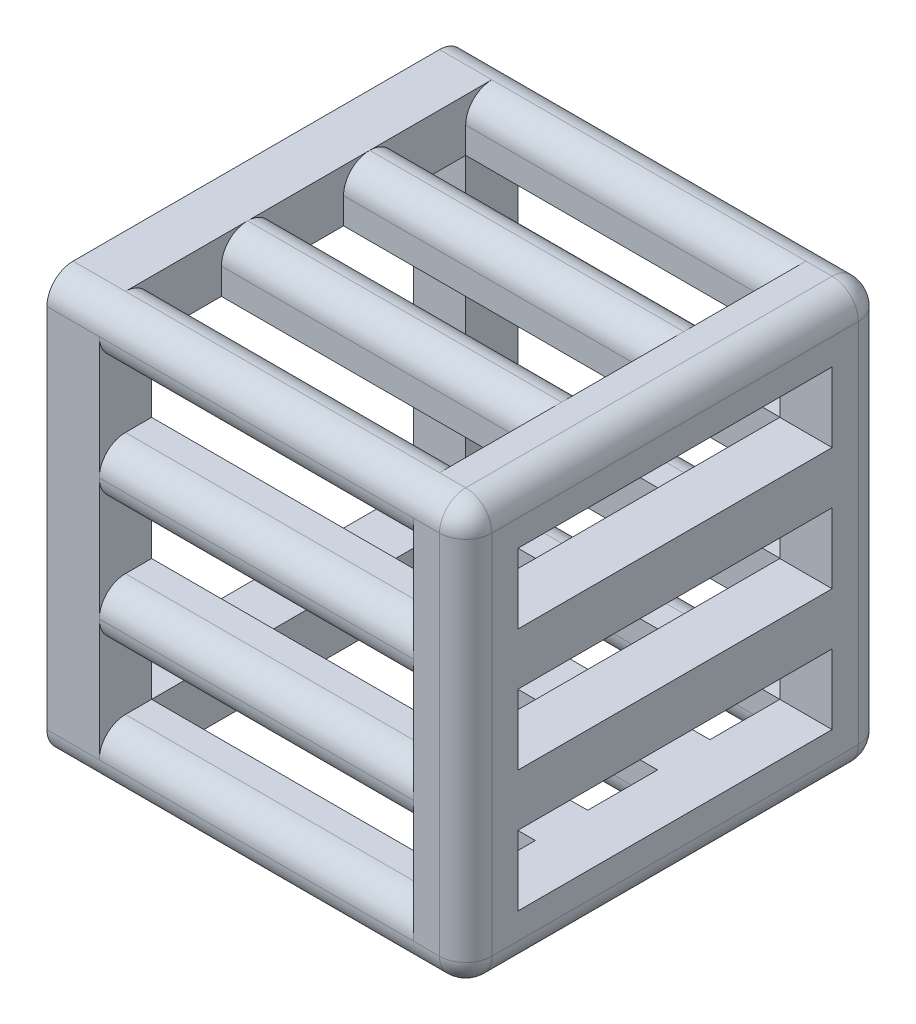
from build123d import *

# Parameters (mm, degrees)
SKETCH_1_W      = 16
SKETCH_1_H      = 16
SKETCH_1_W_2    = 12
SKETCH_1_H_2    = 12
EXTRUDE_1_DEPTH = 2
SKETCH_2_W      = 2
SKETCH_2_H      = 2
EXTRUDE_2_DEPTH = 12
SKETCH_3_W      = 2
SKETCH_3_H      = 2
SKETCH_3_W_2    = 12
SKETCH_3_H_2    = 1.99
EXTRUDE_3_DEPTH = 2
FILLET_1_R      = 1
FILLET_2_R      = 1


with BuildPart() as part:
    # 草图1 → 凸台-拉伸1 (new body)
    with BuildSketch(Plane(origin=(0, 0, 0), x_dir=(0, 0, -1), z_dir=(1, 0, 0))):
        with Locations((8, -8)):
            Rectangle(SKETCH_1_W, SKETCH_1_H)
        with Locations((8, -8)):
            Rectangle(SKETCH_1_W_2, SKETCH_1_H_2, mode=Mode.SUBTRACT)
    extrude(amount=EXTRUDE_1_DEPTH)

    # 草图2 → 凸台-拉伸2 (add)
    with BuildSketch(Plane(origin=(2, 0, 0), x_dir=(0, 0, -1), z_dir=(1, 0, 0))):
        with Locations((5.666666, -1)):
            Rectangle(SKETCH_2_W, SKETCH_2_H)
        with Locations((1, -1)):
            Rectangle(SKETCH_2_W, SKETCH_2_H)
        with Locations((10.333332, -1)):
            Rectangle(SKETCH_2_W, SKETCH_2_H)
        with Locations((15, -1)):
            Rectangle(SKETCH_2_W, SKETCH_2_H)
        with Locations((1, -5.67)):
            Rectangle(SKETCH_2_W, SKETCH_2_H)
        with Locations((1, -10.34)):
            Rectangle(SKETCH_2_W, SKETCH_2_H)
        with Locations((1, -15)):
            Rectangle(SKETCH_2_W, SKETCH_2_H)
        with Locations((10.33, -15)):
            Rectangle(SKETCH_2_W, SKETCH_2_H)
        with Locations((15, -15)):
            Rectangle(SKETCH_2_W, SKETCH_2_H)
        with Locations((5.66, -15)):
            Rectangle(SKETCH_2_W, SKETCH_2_H)
        with Locations((15, -10.33)):
            Rectangle(SKETCH_2_W, SKETCH_2_H)
        with Locations((15, -5.66)):
            Rectangle(SKETCH_2_W, SKETCH_2_H)
    extrude(amount=EXTRUDE_2_DEPTH)

    # 草图3 → 凸台-拉伸3 (add)
    with BuildSketch(Plane(origin=(14, 0, 0), x_dir=(0, 0, -1), z_dir=(1, 0, 0))):
        with Locations((1, -1)):
            Rectangle(SKETCH_3_W, SKETCH_3_H)
        Polygon((2, -2), (0, -2), (0, -16), (2, -16), (2, -14), (2, -11.33), (2, -9.34), (2, -6.66), (2, -4.67), align=None)
        Polygon((2, -14), (2, -16), (16, -16), (16, -14), (14, -14), align=None)
        Polygon((16, 0), (14, 0), (14, -2), (14, -4.67), (14, -6.66), (14, -9.34), (14, -11.33), (14, -14), (16, -14), align=None)
        with Locations((8, -1)):
            Rectangle(SKETCH_3_W_2, SKETCH_3_H)
        with Locations((8, -5.665)):
            Rectangle(SKETCH_3_W_2, SKETCH_3_H_2)
        with Locations((8, -10.335)):
            Rectangle(SKETCH_3_W_2, SKETCH_3_H_2)
    extrude(amount=EXTRUDE_3_DEPTH)

    # 圆角1
    fillet_1_edges = [part.edges().sort_by_distance(p)[0] for p in [
        (16, -16, -8),
        (16, -8, -16),
        (16, 0, -8),
        (16, -8, 0),
        (8, 0, 0),
        (8, 0, -16),
        (8, -16, -16),
        (8, -16, 0),
    ]]
    fillet(fillet_1_edges, radius=FILLET_1_R)

    # 圆角2
    fillet_2_edges = [part.edges().sort_by_distance(p)[0] for p in [
        (8, -16, -2),
        (8, -14, 0),
        (8, -16, -9.33),
        (8, -16, -11.33),
        (8, -16, -4.66),
        (8, -16, -6.66),
        (8, -11.33, -16),
        (8, -9.33, -16),
        (8, -6.66, -16),
        (8, -4.66, -16),
        (8, -2, 0),
        (8, 0, -2),
        (8, -14, -16),
        (8, -16, -14),
        (8, 0, -6.666666),
        (8, 0, -4.666666),
        (8, 0, -11.333332),
        (8, 0, -9.333332),
        (8, 0, -14),
        (8, -2, -16),
        (8, -4.67, 0),
        (8, -6.67, 0),
        (8, -9.34, 0),
        (8, -11.34, 0),
    ]]
    fillet(fillet_2_edges, radius=FILLET_2_R - 0.0001)  # a hair under: the kernel refuses the full size


solid = part.part
